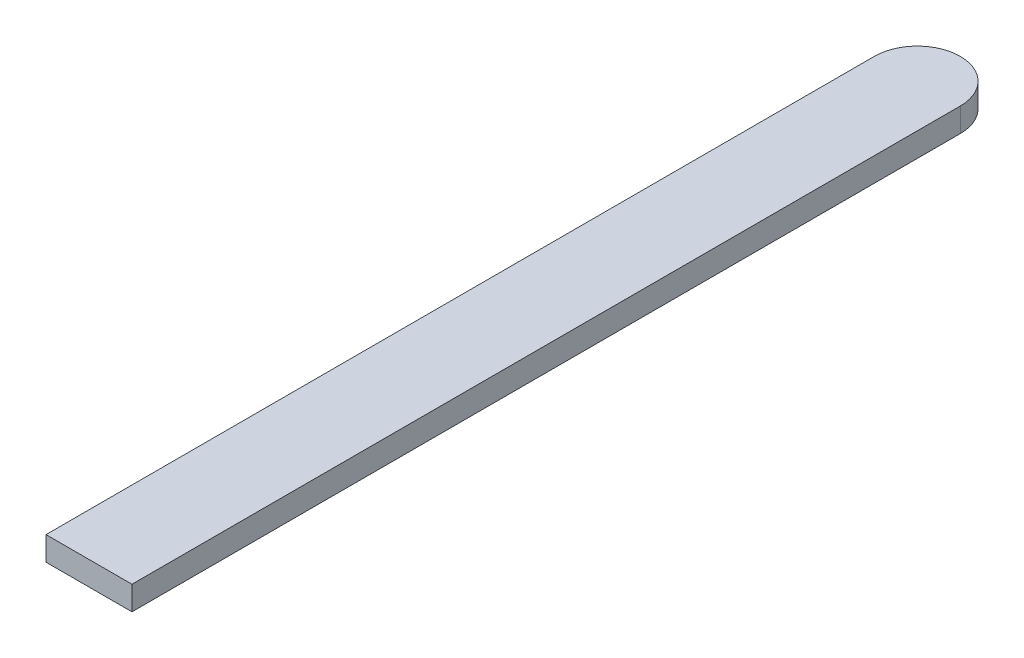
from build123d import *

# Parameters (mm, degrees)
BOSS_EXTRUDE1_DEPTH = 1.6


with BuildPart() as part:
    # Sketch1 → Boss-Extrude1 (new body)
    with BuildSketch(Plane(origin=(0, 0, 0), x_dir=(1, 0, 0), z_dir=(0, 1, 0))):
        with BuildLine():
            Line((-2.875, 35.2425), (-2.875, -20.1575))
            Line((-2.875, -20.1575), (2.875, -20.1575))
            Line((2.875, -20.1575), (2.875, 35.2425))
            ThreePointArc((2.875, 35.2425), (0, 38.1175), (-2.875, 35.2425))
        make_face()
    extrude(amount=BOSS_EXTRUDE1_DEPTH)


solid = part.part
